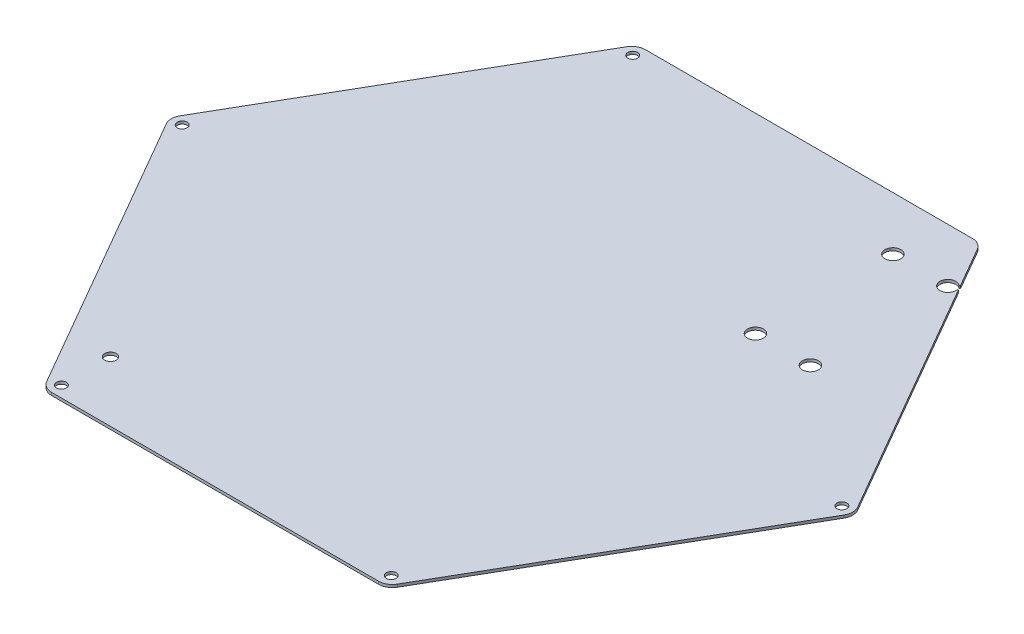
from build123d import *

# Parameters (mm, degrees)
BOSS_EXTRUDE1_DEPTH      = 1
FILLET1_R                = 5
M5_CLEARANCE_HOLE1_D     = 5.8
M5_CLEARANCE_HOLE1_DEPTH = 5
M5_CLEARANCE_HOLE1_TIP   = 1.742495795
M3_CLEARANCE_HOLE1_D     = 3.6
CUT_EXTRUDE1_DEPTH       = 330.362644314
SKETCH10_R               = 2.1
CUT_EXTRUDE2_DEPTH       = 330.362644314


with BuildPart() as part:
    # Sketch1 → Boss-Extrude1 (new body)
    with BuildSketch(Plane(origin=(0, 0, 0), x_dir=(1, 0, 0), z_dir=(0, 1, 0))):
        Polygon((62.353829072, 0), (187.061487217, 0), (249.41531629, 108), (187.061487217, 216), (62.353829072, 216), (0, 108), align=None)
    extrude(amount=BOSS_EXTRUDE1_DEPTH)

    # Fillet1
    fillet1_edges = [part.edges().sort_by_distance(p)[0] for p in [
        (0, 0.5, -108),
        (62.353829072, 0.5, -216),
        (187.061487217, 0.5, -216),
        (249.41531629, 0.5, -108),
        (62.353829072, 0.5, 0),
        (187.061487217, 0.5, 0),
    ]]
    fillet(fillet1_edges, radius=FILLET1_R)

    # M5 Clearance Hole1
    with Locations(Plane(origin=(0, 1, 0), x_dir=(1, 0, 0), z_dir=(0, 1, 0))):
        with Locations((174.707658145, 146.57), (194.707658145, 146.57), (194.707658145, 196.57), (174.707658145, 196.57)):
            Hole(M5_CLEARANCE_HOLE1_D / 2, depth=M5_CLEARANCE_HOLE1_DEPTH)
            with Locations((0, 0, -(M5_CLEARANCE_HOLE1_DEPTH + M5_CLEARANCE_HOLE1_TIP / 2))):  # 118° drill point
                Cone(0, M5_CLEARANCE_HOLE1_D / 2, M5_CLEARANCE_HOLE1_TIP, mode=Mode.SUBTRACT)

    # M3 Clearance Hole1 (through all)
    with Locations(Plane(origin=(0, 1, 0), x_dir=(1, 0, 0), z_dir=(0, 1, 0))):
        with Locations((4.707658145, 108), (64.707658145, 211.923048454), (244.707658145, 108), (184.707658145, 4.076951546), (64.707658145, 4.076951546)):
            Hole(M3_CLEARANCE_HOLE1_D / 2)

    # Sketch9 → Cut-Extrude1 (cut, through all)
    with BuildSketch(Plane(origin=(0, 1, 0), x_dir=(1, 0, 0), z_dir=(0, 1, 0))):
        Polygon((196.564025782, 198.797980968), (196.885814598, 198.983765827), (197.887118897, 197.249455908), (197.565330081, 197.063671049), align=None)
    extrude(amount=-CUT_EXTRUDE1_DEPTH, mode=Mode.SUBTRACT)

    # Sketch10 → Cut-Extrude2 (cut, through all)
    with BuildSketch(Plane(origin=(0, 1, 0), x_dir=(1, 0, 0), z_dir=(0, 1, 0))):
        with Locations((64.707658145, 21.923048454)):
            Circle(SKETCH10_R)
    extrude(amount=-CUT_EXTRUDE2_DEPTH, mode=Mode.SUBTRACT)


solid = part.part
